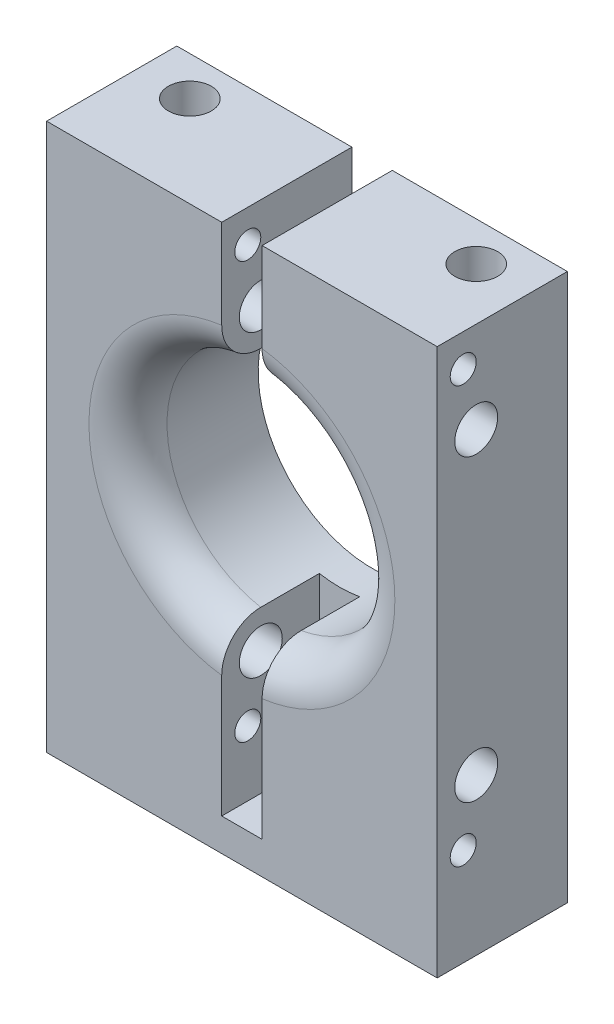
from build123d import *

# Parameters (mm, degrees)
SKETCH_1_W               = 30
SKETCH_1_H               = 42
SKETCH_1_R               = 8.75
EXTRUDE_1_DEPTH          = 10
CUT_EXTRUDE_1_DEPTH      = 40.398604036
CUT_EXTRUDE_1_DEPTH_BACK = 40.398604036
SKETCH_3_R               = 1
HOLE_WIZARD_M4_1_D       = 3.3
HOLE_WIZARD_M4_2_D       = 3.3
FILLET_1_R               = 3
SKETCH_12_W              = 3.1
SKETCH_12_H              = 39.5
CUT_EXTRUDE_3_DEPTH      = 7.5
CUT_EXTRUDE_START        = -6
CUT_EXTRUDE_4_DEPTH      = 6


with BuildPart() as part:
    # 草图1 → 凸台-拉伸1 (new body)
    with BuildSketch(Plane.XY):
        with Locations((0, -2.5)):
            Rectangle(SKETCH_1_W, SKETCH_1_H)
        Circle(SKETCH_1_R, mode=Mode.SUBTRACT)
    extrude(amount=EXTRUDE_1_DEPTH)

    # 草图3 → 切除-拉伸1 (cut, two sides: drawn at the far end of the back side and taken through both)
    with BuildSketch(Plane(origin=(15, 0, 0), x_dir=(0, 0, -1), z_dir=(1, 0, 0)).offset(-CUT_EXTRUDE_1_DEPTH_BACK)):
        with Locations((-8, -16)):
            Circle(SKETCH_3_R)
        with Locations((-8, 16)):
            Circle(SKETCH_3_R)
    extrude(amount=CUT_EXTRUDE_1_DEPTH + CUT_EXTRUDE_1_DEPTH_BACK, mode=Mode.SUBTRACT)

    # M4 螺纹孔1 (through all)
    with Locations(Plane(origin=(0, 18.5, 0), x_dir=(1, 0, 0), z_dir=(0, 1, 0))):
        with Locations((-11, -3), (11, -3)):
            Hole(HOLE_WIZARD_M4_1_D / 2)

    # M4 螺纹孔2 (through all)
    with Locations(Plane(origin=(15, 0, 0), x_dir=(0, 0, -1), z_dir=(1, 0, 0))):
        with Locations((-7, -11.5), (-7, 11.5)):
            Hole(HOLE_WIZARD_M4_2_D / 2)

    # 圆角1
    fillet_1_edges = [part.edges().sort_by_distance(p)[0] for p in [
        (-8.75, 0, 10),
    ]]
    fillet(fillet_1_edges, radius=FILLET_1_R)

    # 草图12 → 切除-拉伸3 (cut)
    with BuildSketch(Plane.XY.offset(10)):
        with Locations((0, -1.25)):
            Rectangle(SKETCH_12_W, SKETCH_12_H)
    extrude(amount=-CUT_EXTRUDE_3_DEPTH, mode=Mode.SUBTRACT)

    # 草图13 → 切除-拉伸4 (cut)
    with BuildSketch(Plane.XY.offset(2.5).offset(CUT_EXTRUDE_START)):
        with BuildLine():
            Line((1.55, 8.611620057), (1.55, 18.5))
            Line((1.55, 18.5), (-1.55, 18.5))
            Line((-1.55, 18.5), (-1.55, 8.611620057))
            ThreePointArc((-1.55, 8.611620057), (0, 8.75), (1.55, 8.611620057))
        make_face()
    extrude(amount=CUT_EXTRUDE_4_DEPTH, mode=Mode.SUBTRACT)


solid = part.part
